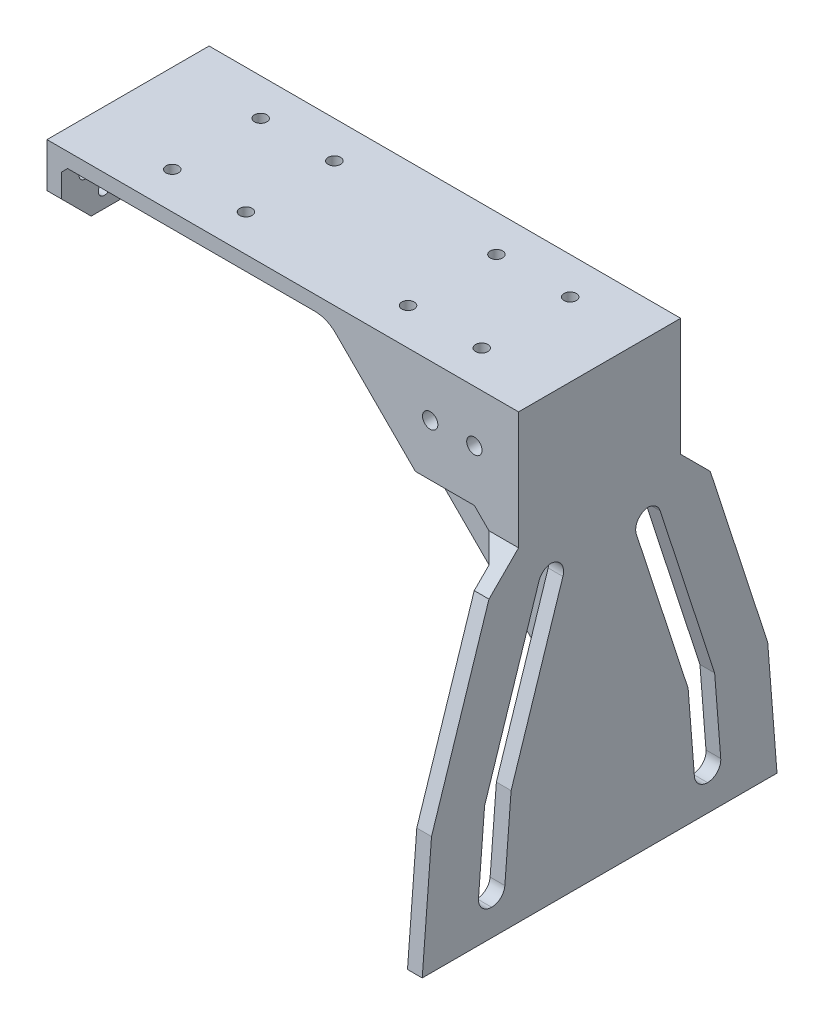
from build123d import *

# Parameters (mm, degrees)
SKETCH_1_W          = 85
SKETCH_1_H          = 55
EXTRUDE_1_DEPTH     = 5
SKETCH_2_W          = 5
SKETCH_2_H          = 55
EXTRUDE_2_DEPTH     = 20
SKETCH_3_W          = 55
SKETCH_3_H          = 5
EXTRUDE_3_DEPTH     = 75
SKETCH_7_R          = 2.1
CUT_EXTRUDE_1_DEPTH = 5
EXTRUDE_4_DEPTH     = 5
FILLET_1_R          = 4.5
RIB_START           = -5
RIB_1_DEPTH         = 10
EXTRUDE_5_DEPTH     = 5
SKETCH_12_R         = 2.6
CUT_EXTRUDE_2_DEPTH = 5
CHAMFER_1_SIZE      = 10
CHAMFER_2_SIZE      = 10
SKETCH_13_R         = 2.1
CUT_EXTRUDE_3_DEPTH = 5
CHAMFER_3_SIZE      = 10
FILLET_2_R          = 10
FILLET_3_R          = 10
CHAMFER_4_SIZE      = 2


# Read off the part's stored shape, not the designer's step: 筋1
with BuildPart() as part:
    # 草图1 → 凸台-拉伸1 (new body)
    with BuildSketch(Plane(origin=(0, 0, 0), x_dir=(1, 0, 0), z_dir=(0, 1, 0))):
        Rectangle(SKETCH_1_W, SKETCH_1_H)
    extrude(amount=EXTRUDE_1_DEPTH)

    # 草图2 → 凸台-拉伸2 (add)
    with BuildSketch(Plane.XZ):
        with Locations((-40, 0)):
            Rectangle(SKETCH_2_W, SKETCH_2_H)
    extrude(amount=EXTRUDE_2_DEPTH)

    # 草图3 → 凸台-拉伸3 (add)
    with BuildSketch(Plane(origin=(42.5, 0, 0), x_dir=(0, 0, -1), z_dir=(1, 0, 0))):
        with Locations((0, 2.5)):
            Rectangle(SKETCH_3_W, SKETCH_3_H)
    extrude(amount=EXTRUDE_3_DEPTH)

    # 草图7 → 切除-拉伸1 (cut)
    with BuildSketch(Plane(origin=(0, 5, 0), x_dir=(1, 0, 0), z_dir=(0, 1, 0))):
        with Locations(Location((-12.5, 15, 0), (0, 0, 270))):
            Circle(SKETCH_7_R)
        with Locations(Location((12.5, 15, 0), (0, 0, 270))):
            Circle(SKETCH_7_R)
        with Locations(Location((67.5, 15, 0), (0, 0, 270))):
            Circle(SKETCH_7_R)
        with Locations(Location((92.5, 15, 0), (0, 0, 270))):
            Circle(SKETCH_7_R)
        with Locations(Location((92.5, -15, 0), (0, 0, 90))):
            Circle(SKETCH_7_R)
        with Locations(Location((67.5, -15, 0), (0, 0, 90))):
            Circle(SKETCH_7_R)
        with Locations(Location((12.5, -15, 0), (0, 0, 90))):
            Circle(SKETCH_7_R)
        with Locations(Location((-12.5, -15, 0), (0, 0, 90))):
            Circle(SKETCH_7_R)
    extrude(amount=-CUT_EXTRUDE_1_DEPTH, mode=Mode.SUBTRACT)

    # 草图8 → 凸台-拉伸4 (add)
    with BuildSketch(Plane(origin=(117.5, 0, 0), x_dir=(0, 0, -1), z_dir=(1, 0, 0))):
        Polygon((-33.188754566, -145), (-27.5, -145), (27.5, -145), (60.188754566, -145), (57.031110104, -105), (37.540925534, -45), (27.5, -34.959074466), (27.5, -20), (27.5, 0), (-27.5, 0), (-27.5, -20), (-27.5, -34.959074466), (-37.540925534, -45), (-57.031110104, -105), (-60.188754566, -145), (-42.188754566, -145), align=None)
        Polygon((-32.478284562, -136), (-41.478284562, -136), (-39.031110104, -105), (-19.540925534, -45), (-10.540925534, -45), (-30.031110104, -105), align=None, mode=Mode.SUBTRACT)
        Polygon((41.478284562, -136), (32.478284562, -136), (30.031110104, -105), (10.540925534, -45), (19.540925534, -45), (39.031110104, -105), align=None, mode=Mode.SUBTRACT)
    extrude(amount=-EXTRUDE_4_DEPTH)

    # 圆角1
    # the kernel refuses this fillet: 4.5 mm, written as the material it adds along each edge
    with BuildSketch(Plane(origin=(117.5, -45, -19.540925534), x_dir=(0, -0.9510797935163557, -0.30894534527143475), z_dir=(-1, 0, 0)), Plane(origin=(117.5, -45, 19.540925534), x_dir=(0, 0, -1), z_dir=(-1, 0, 0))) as fillet_1_piece_1:
        with BuildLine():
            CenterArc((FILLET_1_R * 0.726600080708, FILLET_1_R), FILLET_1_R, 197.995683599, 72.004316401)
            Line((-FILLET_1_R * 0.224479712809, FILLET_1_R * 0.691054654729), (0, 0))
            Line((0, 0), (FILLET_1_R * 0.726600080708, 0))
        make_face()
    extrude(amount=5)
    with BuildSketch(Plane(origin=(117.5, -45, -10.540925534), x_dir=(0, 0, -1), z_dir=(-1, 0, 0)), Plane(origin=(117.5, -45, 10.540925534), x_dir=(0, -0.9510797935163557, 0.30894534527143513), z_dir=(-1, 0, 0))) as fillet_1_piece_2:
        with BuildLine():
            CenterArc((FILLET_1_R * 1.3762728997, FILLET_1_R), FILLET_1_R, 162.004316401, 107.995683599)
            Line((FILLET_1_R * 0.425193106186, FILLET_1_R * 1.30894534527), (0, 0))
            Line((0, 0), (FILLET_1_R * 1.3762728997, 0))
        make_face()
    extrude(amount=5)
    with BuildSketch(Plane(origin=(117.5, -136, -32.478284562), x_dir=(0, 0.9968986380141637, 0.07869628660556646), z_dir=(-1, 0, 0))) as fillet_1_piece_3:
        with BuildLine():
            CenterArc((FILLET_1_R * 0.924169898787, FILLET_1_R), FILLET_1_R, 184.513632187, 85.486367813)
            Line((-FILLET_1_R * 0.0727287392272, FILLET_1_R * 0.921303713394), (0, 0))
            Line((0, 0), (FILLET_1_R * 0.924169898787, 0))
        make_face()
    extrude(amount=5)
    with BuildSketch(Plane(origin=(117.5, -136, -41.478284562), x_dir=(0, 0.9968986380141637, 0.07869628660556578), z_dir=(-1, 0, 0))) as fillet_1_piece_4:
        with BuildLine():
            CenterArc((FILLET_1_R * 1.08205212192, -FILLET_1_R), FILLET_1_R, 90, 94.513632187)
            Line((FILLET_1_R * 0.085153483909, -FILLET_1_R * 1.07869628661), (0, 0))
            Line((0, 0), (FILLET_1_R * 1.08205212192, 0))
        make_face()
    extrude(amount=5)
    with BuildSketch(Plane(origin=(117.5, -136, 32.478284562), x_dir=(0, 0.9968986380141636, -0.078696286605567), z_dir=(-1, 0, 0))) as fillet_1_piece_5:
        with BuildLine():
            CenterArc((FILLET_1_R * 0.924169898787, -FILLET_1_R), FILLET_1_R, 90, 85.486367813)
            Line((-FILLET_1_R * 0.0727287392272, -FILLET_1_R * 0.921303713394), (0, 0))
            Line((0, 0), (FILLET_1_R * 0.924169898787, 0))
        make_face()
    extrude(amount=5)
    with BuildSketch(Plane(origin=(117.5, -136, 41.478284562), x_dir=(0, 0.9968986380141637, -0.07869628660556578), z_dir=(-1, 0, 0))) as fillet_1_piece_6:
        with BuildLine():
            CenterArc((FILLET_1_R * 1.08205212192, FILLET_1_R), FILLET_1_R, 175.486367813, 94.513632187)
            Line((FILLET_1_R * 0.085153483909, FILLET_1_R * 1.07869628661), (0, 0))
            Line((0, 0), (FILLET_1_R * 1.08205212192, 0))
        make_face()
    extrude(amount=5)

    # 筋1 outline → 筋1 (add)
    with BuildSketch(Plane.XY.offset(RIB_START)):
        Polygon((-37.5, 0), (-37.5, -20), (37.5, -20), (112.5, -95), (112.5, 0), align=None)
    extrude(amount=RIB_1_DEPTH)

    # 草图10 → 凸台-拉伸5 (add)
    with BuildSketch(Plane.XY.offset(27.5)):
        Polygon((112.5, 0), (112.5, -30), (82.5, -30), (52.5, 0), align=None)
    extrude_5 = extrude(amount=-EXTRUDE_5_DEPTH)

    # 草图12 → 切除-拉伸2 (cut)
    with BuildSketch(Plane.XY.offset(27.5)):
        with Locations((87.5, -12.5)):
            Circle(SKETCH_12_R)
        with Locations((102.5, -12.5)):
            Circle(SKETCH_12_R)
    cut_extrude_2 = extrude(amount=-CUT_EXTRUDE_2_DEPTH, mode=Mode.SUBTRACT)

    # 镜向2: 凸台-拉伸5, 切除-拉伸2 across plane
    add(extrude_5.mirror(Plane.XY))
    add(cut_extrude_2.mirror(Plane.XY), mode=Mode.SUBTRACT)

    # 倒角1
    chamfer_1_edges = [part.edges().sort_by_distance(p)[0] for p in [
        (112.5, -30, -25),
        (112.5, -30, 25),
    ]]
    chamfer(chamfer_1_edges, length=CHAMFER_1_SIZE)

    # 倒角2
    chamfer_2_edges = [part.edges().sort_by_distance(p)[0] for p in [
        (112.5, 0, -13.75),
        (112.5, 0, 13.75),
    ]]
    chamfer(chamfer_2_edges, length=CHAMFER_2_SIZE)

    # 草图13 → 切除-拉伸3 (cut)
    with BuildSketch(Plane(origin=(-37.5, 0, 0), x_dir=(0, 0, -1), z_dir=(1, 0, 0))):
        with Locations((-19.5, -6)):
            Circle(SKETCH_13_R)
        with Locations((-13, -14)):
            Circle(SKETCH_13_R)
    cut_extrude_3 = extrude(amount=-CUT_EXTRUDE_3_DEPTH, mode=Mode.SUBTRACT)

    # 镜向3: 切除-拉伸3 across plane
    add(cut_extrude_3.mirror(Plane.XY), mode=Mode.SUBTRACT)

    # 倒角3
    chamfer_3_edges = [part.edges().sort_by_distance(p)[0] for p in [
        (-40, -20, 27.5),
        (-40, -20, -27.5),
    ]]
    chamfer(chamfer_3_edges, length=CHAMFER_3_SIZE)

    # 圆角2
    fillet_2_edges = [part.edges().sort_by_distance(p)[0] for p in [
        (112.5, -95, 0),
        (37.5, -20, 0),
    ]]
    fillet(fillet_2_edges, radius=FILLET_2_R)

    # 圆角3
    fillet_3_edges = [part.edges().sort_by_distance(p)[0] for p in [
        (52.5, 0, 25),
        (52.5, 0, -25),
    ]]
    fillet(fillet_3_edges, radius=FILLET_3_R)

    # 倒角4
    chamfer_4_edges = [part.edges().sort_by_distance(p)[0] for p in [
        (-37.5, 0, -16.25),
        (-37.5, 0, 16.25),
    ]]
    chamfer(chamfer_4_edges, length=CHAMFER_4_SIZE)


solid = part.part
